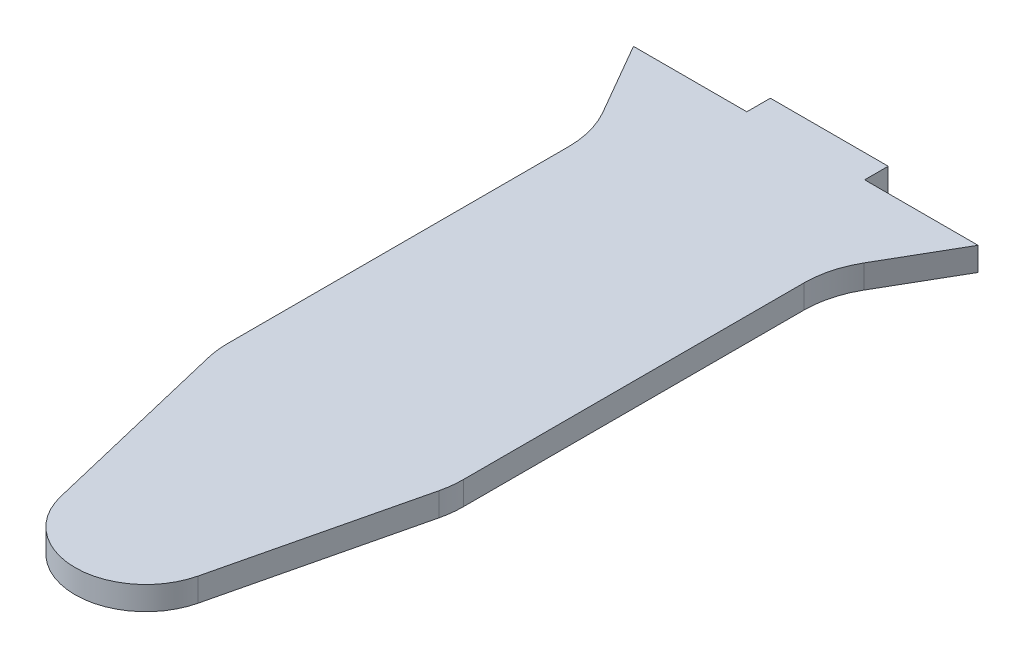
from build123d import *

# Parameters (mm, degrees)
BOSS_EXTRUDE1_DEPTH = 6.35
FILLET1_R           = 25.4


with BuildPart() as part:
    # Sketch2 → Boss-Extrude1 (new body)
    with BuildSketch(Plane(origin=(0, 69.85, 0), x_dir=(1, 0, 0), z_dir=(0, 1, 0))):
        with BuildLine():
            Line((-15.875, 6.35), (15.875, 6.35))
            Line((15.875, 6.35), (15.875, 0))
            Line((15.875, 0), (46.414696837, 0))
            Line((46.414696837, 0), (35.152954744, -19.505909488))
            ThreePointArc((35.152954744, -19.505909488), (32.615484012, -25.631905742), (31.75, -32.205909488))
            Line((31.75, -32.205909488), (31.75, -127))
            Line((31.75, -127), (18.526483585, -182.235302241))
            ThreePointArc((18.526483585, -182.235302241), (0, -196.85), (-18.526483585, -182.235302241))
            Line((-18.526483585, -182.235302241), (-31.75, -127))
            Line((-31.75, -127), (-31.75, -32.205909488))
            ThreePointArc((-31.75, -32.205909488), (-32.615484012, -25.631905742), (-35.152954744, -19.505909488))
            Line((-35.152954744, -19.505909488), (-46.414696837, 0))
            Line((-46.414696837, 0), (-15.875, 0))
            Line((-15.875, 0), (-15.875, 6.35))
        make_face()
    extrude(amount=BOSS_EXTRUDE1_DEPTH)

    # Fillet1
    fillet1_edges = [part.edges().sort_by_distance(p)[0] for p in [
        (31.75, 73.025, 127),
        (-31.75, 73.025, 127),
    ]]
    fillet(fillet1_edges, radius=FILLET1_R)


solid = part.part
